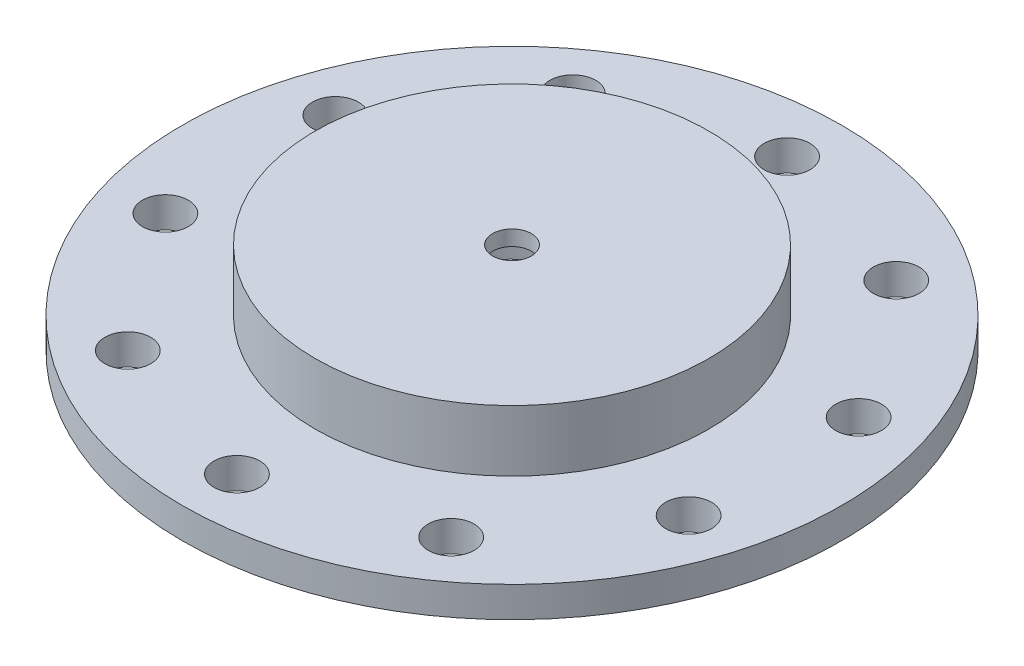
from build123d import *

# Parameters (mm, degrees)
SKETCH2_R           = 107.826846
SKETCH2_R_2         = 7.5
BOSS_EXTRUDE1_DEPTH = 10
SKETCH3_R           = 71.687
SKETCH3_R_2         = 64.447846
CUT_EXTRUDE1_DEPTH  = 3
SKETCH4_W           = 3
SKETCH4_H           = 5
CUT_EXTRUDE2_DEPTH  = 153.817726186
CIRPATTERN1_COUNT   = 35
SKETCH5_R           = 47.826846
CUT_EXTRUDE3_DEPTH  = 153.817726186
SKETCH6_R           = 64.447846
SKETCH6_R_2         = 47.826846
BOSS_EXTRUDE3_DEPTH = 10
SKETCH8_W           = 3
SKETCH8_H           = 5
CUT_EXTRUDE4_DEPTH  = 154.796155468
CIRPATTERN7_COUNT   = 35
SKETCH9_R           = 64.447846
SKETCH9_R_2         = 57.826846
BOSS_EXTRUDE4_DEPTH = 5
SKETCH10_R          = 64.447846
SKETCH10_R_2        = 6.35
BOSS_EXTRUDE5_DEPTH = 5
BOSS_EXTRUDE7_START = 10
SKETCH11_R          = 47.826846
SKETCH11_R_2        = 36.6524
BOSS_EXTRUDE7_DEPTH = 10
SKETCH12_R          = 47.826846
SKETCH12_R_2        = 36.6524
BOSS_EXTRUDE8_DEPTH = 10


with BuildPart() as part:
    # Sketch2 → Boss-Extrude1 (new body)
    with BuildSketch(Plane(origin=(0, 0, 0), x_dir=(1, 0, 0), z_dir=(0, 1, 0))):
        Circle(SKETCH2_R)
        with Locations((0, 90)):
            Circle(SKETCH2_R_2, mode=Mode.SUBTRACT)
        with Locations((52.900672706, 72.811529494)):
            Circle(SKETCH2_R_2, mode=Mode.SUBTRACT)
        with Locations((85.595086467, 27.811529494)):
            Circle(SKETCH2_R_2, mode=Mode.SUBTRACT)
        with Locations((85.595086467, -27.811529494)):
            Circle(SKETCH2_R_2, mode=Mode.SUBTRACT)
        with Locations((52.900672706, -72.811529494)):
            Circle(SKETCH2_R_2, mode=Mode.SUBTRACT)
        with Locations((0, -90)):
            Circle(SKETCH2_R_2, mode=Mode.SUBTRACT)
        with Locations((-52.900672706, -72.811529494)):
            Circle(SKETCH2_R_2, mode=Mode.SUBTRACT)
        with Locations((-85.595086467, -27.811529494)):
            Circle(SKETCH2_R_2, mode=Mode.SUBTRACT)
        with Locations((-85.595086467, 27.811529494)):
            Circle(SKETCH2_R_2, mode=Mode.SUBTRACT)
        with Locations((-52.900672706, 72.811529494)):
            Circle(SKETCH2_R_2, mode=Mode.SUBTRACT)
    extrude(amount=BOSS_EXTRUDE1_DEPTH)

    # Sketch3 → Cut-Extrude1 (cut)
    with BuildSketch(Plane.XZ):
        Circle(SKETCH3_R)
        Circle(SKETCH3_R_2, mode=Mode.SUBTRACT)
    extrude(amount=-CUT_EXTRUDE1_DEPTH, mode=Mode.SUBTRACT)

    # Sketch4 → Cut-Extrude2 (cut, through all)
    with BuildSketch(Plane(origin=(0, 10, 0), x_dir=(1, 0, 0), z_dir=(0, 1, 0))):
        with Locations((0, 55.326846)):
            Rectangle(SKETCH4_W, SKETCH4_H)
    cut_extrude2 = extrude(amount=-CUT_EXTRUDE2_DEPTH, mode=Mode.SUBTRACT)

    # CirPattern1: Cut-Extrude2 ×35 about axis
    cirpattern1_axis = Axis((0, 10, 0), (0, 1, 0))
    for i in range(1, CIRPATTERN1_COUNT):
        add(cut_extrude2.rotate(cirpattern1_axis, i * 360 / CIRPATTERN1_COUNT), mode=Mode.SUBTRACT)

    # Sketch5 → Cut-Extrude3 (cut, through all)
    with BuildSketch(Plane(origin=(0, 10, 0), x_dir=(1, 0, 0), z_dir=(0, 1, 0))):
        Circle(SKETCH5_R)
    extrude(amount=-CUT_EXTRUDE3_DEPTH, mode=Mode.SUBTRACT)



with BuildPart() as body_2:
    # Sketch6 → Boss-Extrude3 (new body)
    with BuildSketch(Plane(origin=(0, 10, 0), x_dir=(1, 0, 0), z_dir=(0, 1, 0))):
        Circle(SKETCH6_R)
        Circle(SKETCH6_R_2, mode=Mode.SUBTRACT)
    extrude(amount=BOSS_EXTRUDE3_DEPTH)

    # Sketch8 → Cut-Extrude4 (cut, through all)
    with BuildSketch(Plane(origin=(0, 20, 0), x_dir=(1, 0, 0), z_dir=(0, 1, 0))):
        with Locations((0, 55.326846)):
            Rectangle(SKETCH8_W, SKETCH8_H)
    cut_extrude4 = extrude(amount=-CUT_EXTRUDE4_DEPTH, mode=Mode.SUBTRACT)

    # CirPattern7: Cut-Extrude4 ×35 about axis
    cirpattern7_axis = Axis((0, 20, 0), (0, 1, 0))
    for i in range(1, CIRPATTERN7_COUNT):
        add(cut_extrude4.rotate(cirpattern7_axis, i * 360 / CIRPATTERN7_COUNT), mode=Mode.SUBTRACT)

    # Sketch9 → Boss-Extrude4 (add)
    with BuildSketch(Plane(origin=(0, 20, 0), x_dir=(1, 0, 0), z_dir=(0, 1, 0))):
        Circle(SKETCH9_R)
        Circle(SKETCH9_R_2, mode=Mode.SUBTRACT)
    extrude(amount=BOSS_EXTRUDE4_DEPTH)

    # Sketch10 → Boss-Extrude5 (add)
    with BuildSketch(Plane(origin=(0, 25, 0), x_dir=(1, 0, 0), z_dir=(0, 1, 0))):
        Circle(SKETCH10_R)
        Circle(SKETCH10_R_2, mode=Mode.SUBTRACT)
    extrude(amount=BOSS_EXTRUDE5_DEPTH)


with BuildPart() as part_1:
    add(part.part)

    add(body_2.part)  # Boss-Extrude7 merges body 2
    # Sketch11 → Boss-Extrude7 (add)
    with BuildSketch(Plane(origin=(0, 10, 0), x_dir=(1, 0, 0), z_dir=(0, 1, 0)).offset(BOSS_EXTRUDE7_START)):
        Circle(SKETCH11_R)
        Circle(SKETCH11_R_2, mode=Mode.SUBTRACT)
    extrude(amount=-BOSS_EXTRUDE7_DEPTH)

    # Sketch12 → Boss-Extrude8 (add)
    with BuildSketch(Plane.XZ.offset(-10)):
        Circle(SKETCH12_R)
        Circle(SKETCH12_R_2, mode=Mode.SUBTRACT)
    extrude(amount=BOSS_EXTRUDE8_DEPTH)


solid = part_1.part
